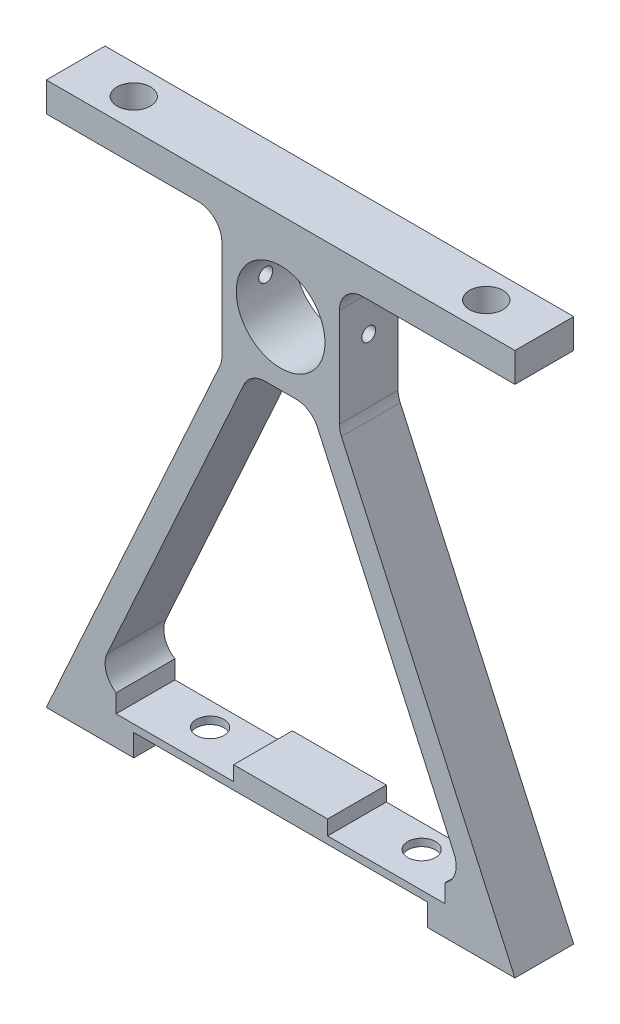
from build123d import *

# Parameters (mm, degrees)
SKETCH3_R               = 9.5885
BOSS_EXTRUDE1_DEPTH     = 12.7
SKETCH4_R               = 3.614257139
CUT_EXTRUDE1_DEPTH      = 6.35
CUT_EXTRUDE2_START      = -12.7
CUT_EXTRUDE2_OUTLINE_R  = 1.5
CUT_EXTRUDE2_DEPTH      = 25.4
CUT_EXTRUDE3_DEPTH      = 126.664030474
CUT_EXTRUDE3_DEPTH_BACK = 126.664030474
SKETCH8_W               = 25.4
SKETCH8_H               = 5.08
SKETCH9_R               = 3
CUT_EXTRUDE4_DEPTH      = 123.783240632


# Read off the part's stored shape, not the designer's step: Cut-Extrude2
with BuildPart() as part:
    # Sketch3 → Boss-Extrude1 (new body)
    with BuildSketch(Plane.XY):
        with BuildLine():
            Line((50.652428891, 3.175), (-50.652428891, 3.175))
            Line((-50.652428891, 3.175), (-50.652428891, -3.175))
            Line((-50.652428891, -3.175), (-17.78, -3.175))
            ThreePointArc((-17.78, -3.175), (-14.187897552, -4.662897552), (-12.7, -8.255))
            Line((-12.7, -8.255), (-12.7, -29.595434395))
            ThreePointArc((-12.7, -29.595434395), (-12.814872576, -30.66963627), (-13.154295145, -31.69525691))
            Line((-13.154295145, -31.69525691), (-50.652428891, -114.3))
            Line((-50.652428891, -114.3), (-31.75, -114.3))
            Line((-31.75, -114.3), (-31.75, -109.5375))
            Line((-31.75, -109.5375), (31.75, -109.5375))
            Line((31.75, -109.5375), (31.75, -114.3))
            Line((31.75, -114.3), (50.652428891, -114.3))
            Line((50.652428891, -114.3), (13.154295145, -31.69525691))
            ThreePointArc((13.154295145, -31.69525691), (12.814872576, -30.66963627), (12.7, -29.595434395))
            Line((12.7, -29.595434395), (12.7, -8.255))
            ThreePointArc((12.7, -8.255), (14.187897552, -4.662897552), (17.78, -3.175))
            Line((17.78, -3.175), (50.652428891, -3.175))
            Line((50.652428891, -3.175), (50.652428891, 3.175))
        make_face()
        with Locations((0, -15.875)):
            Circle(SKETCH3_R, mode=Mode.SUBTRACT)
        with BuildLine():
            Line((-7.97501727, -32.575611881), (-37.490421301, -97.595177486))
            ThreePointArc((-37.490421301, -97.595177486), (-37.135167146, -102.446299841), (-32.864716446, -104.775))
            Line((-32.864716446, -104.775), (0, -104.775))
            Line((0, -104.775), (32.864716446, -104.775))
            ThreePointArc((32.864716446, -104.775), (37.135167146, -102.446299841), (37.490421301, -97.595177486))
            Line((37.490421301, -97.595177486), (7.97501727, -32.575611881))
            ThreePointArc((7.97501727, -32.575611881), (6.100612256, -30.404983695), (3.349312415, -29.595434395))
            Line((3.349312415, -29.595434395), (-3.349312415, -29.595434395))
            ThreePointArc((-3.349312415, -29.595434395), (-6.100612256, -30.404983695), (-7.97501727, -32.575611881))
        make_face(mode=Mode.SUBTRACT)
    extrude(amount=BOSS_EXTRUDE1_DEPTH)

    # Sketch4 → Cut-Extrude1 (cut)
    with BuildSketch(Plane(origin=(0, 3.175, 0), x_dir=(1, 0, 0), z_dir=(0, 1, 0))):
        with Locations(Location((-38.1, -6.35, 0), (0, 0, 180))):
            Circle(SKETCH4_R)
        with Locations(Location((38.1, -6.35, 0), (0, 0, 180))):
            Circle(SKETCH4_R)
    extrude(amount=-CUT_EXTRUDE1_DEPTH, mode=Mode.SUBTRACT)

    # Cut-Extrude2 outline → Cut-Extrude2 (cut)
    with BuildSketch(Plane.YZ.offset(CUT_EXTRUDE2_START)):
        with Locations((-15.883331584, 6.35)):
            Circle(CUT_EXTRUDE2_OUTLINE_R)
    extrude(amount=CUT_EXTRUDE2_DEPTH, mode=Mode.SUBTRACT)

    # Sketch8 → Cut-Extrude3 (cut, two sides: drawn at the far end of the back side and taken through both)
    with BuildSketch(Plane.XY.offset(12.7).offset(-CUT_EXTRUDE3_DEPTH_BACK)):
        with Locations((-22.86, -105.41)):
            Rectangle(SKETCH8_W, SKETCH8_H)
        with Locations((22.86, -105.41)):
            Rectangle(SKETCH8_W, SKETCH8_H)
    extrude(amount=CUT_EXTRUDE3_DEPTH + CUT_EXTRUDE3_DEPTH_BACK, mode=Mode.SUBTRACT)

    # Sketch9 → Cut-Extrude4 (cut, through all)
    with BuildSketch(Plane(origin=(0, -107.95, 0), x_dir=(1, 0, 0), z_dir=(0, 1, 0))):
        with Locations(Location((-22.86, -5.08, 0), (0, 0, 270))):
            Circle(SKETCH9_R)
        with Locations((22.86, -5.08)):
            Circle(SKETCH9_R)
    extrude(amount=-CUT_EXTRUDE4_DEPTH, mode=Mode.SUBTRACT)


solid = part.part
